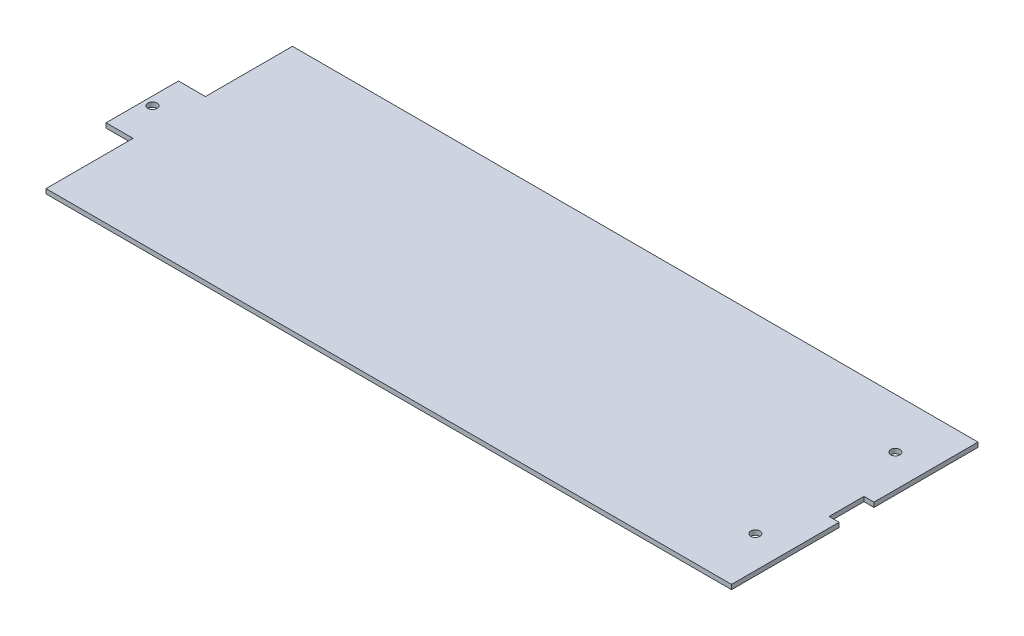
from build123d import *

# Parameters (mm, degrees)
BOSS_EXTRUDE1_START = 2
SKETCH1_R           = 3
BOSS_EXTRUDE1_DEPTH = 3


with BuildPart() as part:
    # Sketch1 → Boss-Extrude1 (new body)
    with BuildSketch(Plane(origin=(0, 0, 0), x_dir=(1, 0, 0), z_dir=(0, 1, 0)).offset(BOSS_EXTRUDE1_START)):
        Polygon((-284.735528935, -559.972287809), (-302.235528935, -559.972287809), (-302.235528935, -606.972287809), (-284.735528935, -606.972287809), (-284.735528935, -663.472287809), (160.264471065, -663.472287809), (160.264471065, -593.610196396), (153.764471065, -593.610196396), (153.764471065, -571.010196396), (160.264471065, -571.010196396), (160.264471065, -503.472287809), (-284.735528935, -503.472287809), align=None)
        with Locations((139.486711961, -627.254171538)):
            Circle(SKETCH1_R, mode=Mode.SUBTRACT)
        with Locations((-296.74646616, -582.310196396)):
            Circle(SKETCH1_R, mode=Mode.SUBTRACT)
        with Locations((139.102370463, -535.972287809)):
            Circle(SKETCH1_R, mode=Mode.SUBTRACT)
    extrude(amount=BOSS_EXTRUDE1_DEPTH)


solid = part.part
